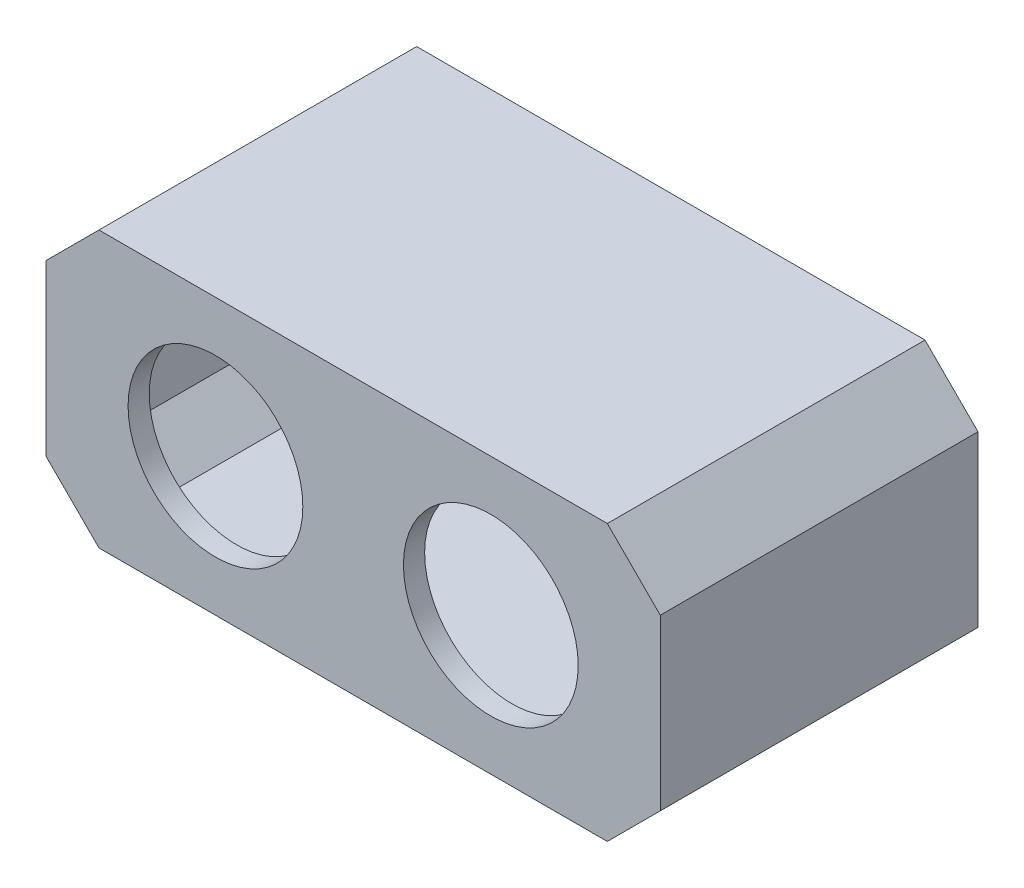
from build123d import *

# Parameters (mm, degrees)
SKETCH1_W          = 58
SKETCH1_H          = 26
SKULL_BLOCK_DEPTH  = 30
SKULL_CHAMFER_SIZE = 5
HOLLOW_SKULL_T     = -2
EYE_HOLE_REACH     = 45.704
SKETCH2_R          = 8.25
SKETCH3_R          = 12
NECK_MOUNT_DEPTH   = 1


with BuildPart() as part:
    # Sketch1 → skull block (new body)
    with BuildSketch(Plane.XY):
        Rectangle(SKETCH1_W, SKETCH1_H)
    extrude(amount=-SKULL_BLOCK_DEPTH)

    # skull chamfer
    skull_chamfer_edges = [part.edges().sort_by_distance(p)[0] for p in [
        (29, -13, -15),
        (-29, -13, -15),
        (-29, 13, -15),
        (29, 13, -15),
    ]]
    chamfer(skull_chamfer_edges, length=SKULL_CHAMFER_SIZE)

    # hollow skull
    hollow_skull_openings = [part.faces().sort_by_distance(p)[0] for p in [
        (0, 0, -30),
    ]]
    offset(amount=HOLLOW_SKULL_T, openings=hollow_skull_openings, kind=Kind.INTERSECTION)

    # Sketch2 → eye hole (cut, up to next)
    with BuildSketch(Plane.XY, mode=Mode.PRIVATE) as eye_hole_sk1:
        with Locations((13, 0)):
            Circle(SKETCH2_R)
    eye_hole_tool1 = extrude(eye_hole_sk1.sketch, amount=-EYE_HOLE_REACH, mode=Mode.PRIVATE) & part.part
    eye_hole = eye_hole_tool1.solids().sort_by_distance((13, 0, 0))[0]
    add(eye_hole, mode=Mode.SUBTRACT)

    # mirror eye hole: eye hole across plane
    add(eye_hole.mirror(Plane(origin=(0, 0, 0), x_dir=(0, 0, 1), z_dir=(1, 0, 0))), mode=Mode.SUBTRACT)

    # Sketch3 → neck mount (cut)
    with BuildSketch(Plane.XZ.offset(13)):
        with Locations((0, -15)):
            Circle(SKETCH3_R)
    extrude(amount=-NECK_MOUNT_DEPTH, mode=Mode.SUBTRACT)


solid = part.part
